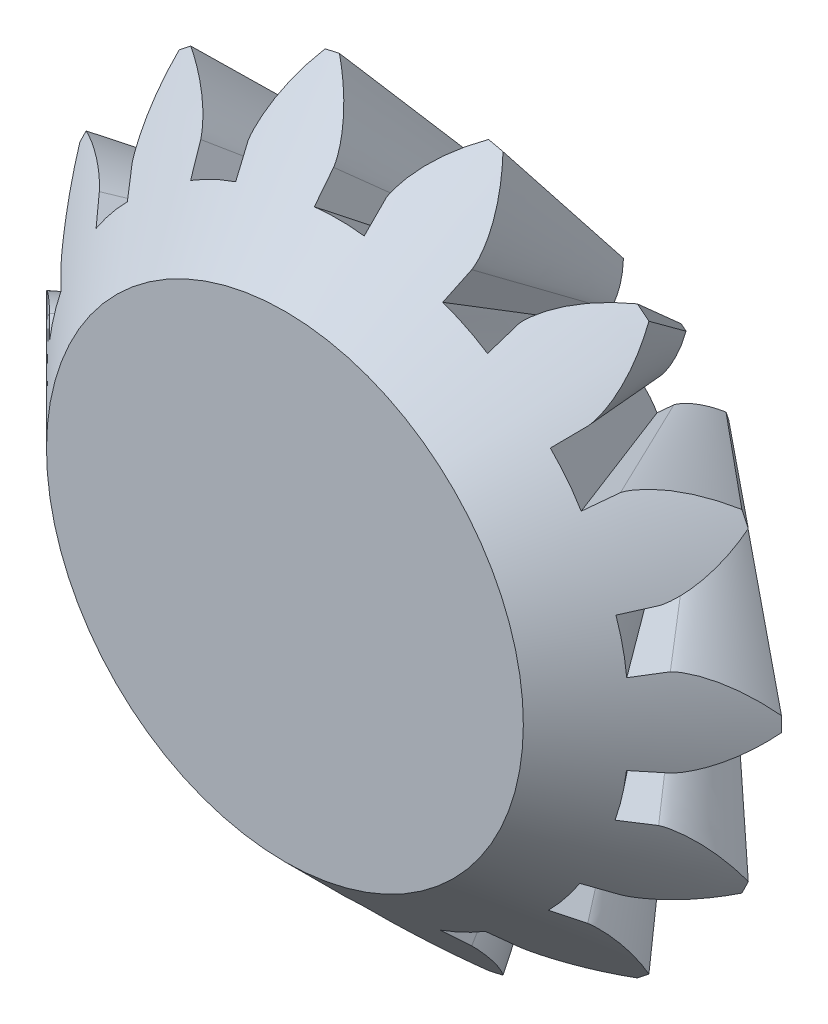
from build123d import *

# Parameters (mm, degrees)
PATTERN_CIRCULAR_1_COUNT = 14


# Read off the part's stored shape, not the designer's step: 旋转1
with BuildPart() as part:
    # 旋转1 outline → 旋转1 (revolve)
    with BuildSketch(Plane.XZ):
        Polygon((0, -5), (0, -10.387787534), (2.400005843, -10.387787534), (3.309772036, -11.297553727), (7.707106781, -7.707106781), (5, -5), align=None)
    revolve(axis=Axis((0, 0, 0), (0, 0, 1)))

    # 草图3 → 切除-放样2 section 0
    with BuildSketch(Plane(origin=(0, 2.050252532, -2.050252532), x_dir=(1, 0, 0), z_dir=(0, 0.7071067811865466, 0.7071067811865486)), mode=Mode.PRIVATE) as loft_2_s0:
        with BuildLine():
            Line((0.552633929, 6.37909425), (0.552633929, 5.723381495))
            ThreePointArc((0.552633929, 5.723381495), (0.028297221, 5.749930371), (-0.496275393, 5.728543509))
            Line((-0.496275393, 5.728543509), (-0.552633929, 6.37909425))
            add(Edge.make_bspline(
                [(-0.552633929, 6.37909425), (-0.553196583, 6.384256086), (-0.555128235, 6.398690373), (-0.560173913, 6.425789935), (-0.570369314, 6.469631333), (-0.58622343, 6.524856205), (-0.609965222, 6.595352224), (-0.642066575, 6.677124447), (-0.681613526, 6.765477755), (-0.729167568, 6.859793414), (-0.780554346, 6.952151815), (-0.835419362, 7.042545855), (-0.893284757, 7.130945077), (-0.967090003, 7.235952201), (-1.060706411, 7.358899556), (-1.177342406, 7.497961093), (-1.317965434, 7.649942734), (-1.469809226, 7.798273925), (-1.626116066, 7.938692803), (-1.791547339, 8.073815084), (-1.956909846, 8.199731525), (-2.135818784, 8.323152759), (-2.304651162, 8.433354939), (-2.461033396, 8.524804584), (-2.554099389, 8.577736547), (-2.607545801, 8.606919055), (-2.615897289, 8.611450596)],
                knots=[0, 0, 0, 0, 0, 0.005376748, 0.015083688, 0.02853182, 0.046610139, 0.064854849, 0.092110525, 0.119476175, 0.146842495, 0.174208853, 0.201574955, 0.228941013, 0.256307345, 0.307035032, 0.361767351, 0.41649966, 0.471231936, 0.525964281, 0.580696615, 0.635428982, 0.690161387, 0.744893688, 0.799626083, 0.809638412, 0.809638412, 0.809638412, 0.809638412, 0.809638412], degree=4))
            ThreePointArc((-2.615897289, 8.611450596), (0, 9), (2.615897289, 8.611450596))
            add(Edge.make_bspline(
                [(0.552633929, 6.37909425), (0.553196583, 6.384256086), (0.555128235, 6.398690373), (0.560173913, 6.425789935), (0.570369314, 6.469631333), (0.58622343, 6.524856205), (0.609965222, 6.595352224), (0.642066575, 6.677124447), (0.681613526, 6.765477755), (0.729167568, 6.859793414), (0.780554346, 6.952151815), (0.835419362, 7.042545855), (0.893284757, 7.130945077), (0.967090003, 7.235952201), (1.060706411, 7.358899556), (1.177342406, 7.497961093), (1.317965434, 7.649942734), (1.469809226, 7.798273925), (1.626116066, 7.938692803), (1.791547339, 8.073815084), (1.956909846, 8.199731525), (2.135818784, 8.323152759), (2.304651162, 8.433354939), (2.461033396, 8.524804584), (2.554099389, 8.577736547), (2.607545801, 8.606919055), (2.615897289, 8.611450596)],
                knots=[0, 0, 0, 0, 0, 0.005376748, 0.015083688, 0.02853182, 0.046610139, 0.064854849, 0.092110525, 0.119476175, 0.146842495, 0.174208853, 0.201574955, 0.228941013, 0.256307345, 0.307035032, 0.361767351, 0.41649966, 0.471231936, 0.525964281, 0.580696615, 0.635428982, 0.690161387, 0.744893688, 0.799626083, 0.809638412, 0.809638412, 0.809638412, 0.809638412, 0.809638412], degree=4))
        make_face()
    loft_2 = loft([loft_2_s0.sketch, Vertex(0, 0, -14)], mode=Mode.SUBTRACT)

    # 阵列(圆周)1: 切除-放样2 ×14 about axis
    pattern_circular_1_axis = Axis((0, 0, -11.297553727), (0, 0, 1))
    for i in range(1, PATTERN_CIRCULAR_1_COUNT):
        add(loft_2.rotate(pattern_circular_1_axis, i * 360 / PATTERN_CIRCULAR_1_COUNT), mode=Mode.SUBTRACT)


solid = part.part
